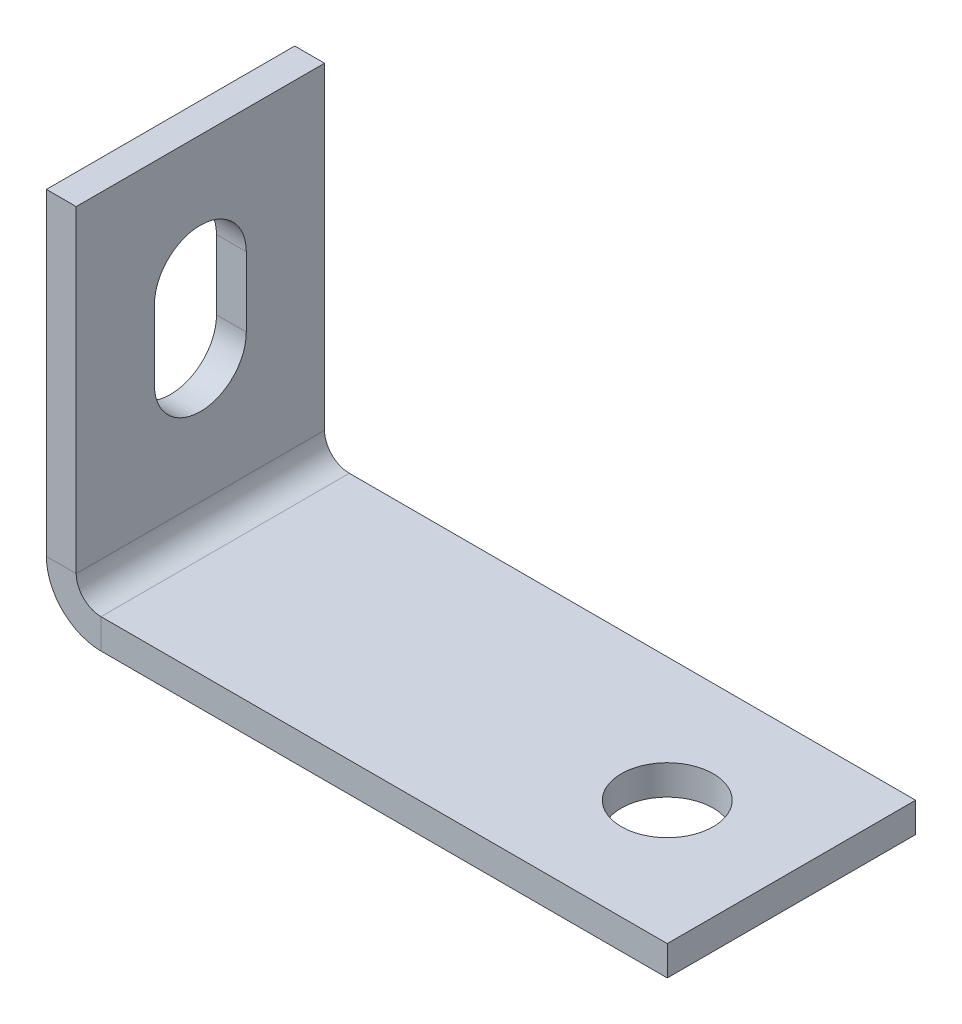
from build123d import *

# Parameters (mm, degrees)
T_LE_DE_BASE_PLI_E1_DEPTH = 10
ENL_V_MAT_EXTRU_1_REACH   = 32.256
ESQUISSE6_R               = 1.85
ENL_V_MAT_EXTRU_2_REACH   = 31.857


# Sheet-metal steps are written as plain solids
with BuildPart() as part:
    # Esquisse1 → Tôle de base pliée1 (new body)
    with BuildSketch(Plane.XY):
        with BuildLine():
            Line((0, 15), (0, 2.2))
            ThreePointArc((0, 2.2), (0.644365081, 0.644365081), (2.2, 0))
            Line((2.2, 0), (25, 0))
            Line((25, 0), (25, 1.2))
            Line((25, 1.2), (2.2, 1.2))
            ThreePointArc((2.2, 1.2), (1.492893219, 1.492893219), (1.2, 2.2))
            Line((1.2, 2.2), (1.2, 15))
            Line((1.2, 15), (0, 15))
        make_face()
    extrude(amount=T_LE_DE_BASE_PLI_E1_DEPTH)

    # Esquisse6 → Enlèv. mat.-Extru.1 (cut, up to next)
    with BuildSketch(Plane(origin=(0, 1.2, 0), x_dir=(1, 0, 0), z_dir=(0, 1, 0)), mode=Mode.PRIVATE) as enl_v_mat_extru_1_sk1:
        with Locations(Location((20, -5, 0), (0, 0, 270))):
            Circle(ESQUISSE6_R)
    enl_v_mat_extru_1_tool1 = extrude(enl_v_mat_extru_1_sk1.sketch, amount=-ENL_V_MAT_EXTRU_1_REACH, mode=Mode.PRIVATE) & part.part
    add(enl_v_mat_extru_1_tool1.solids().sort_by_distance((20, 1.2, 5))[0], mode=Mode.SUBTRACT)

    # Esquisse7 → Enlèv. mat.-Extru.2 (cut, up to next)
    with BuildSketch(Plane(origin=(1.2, 0, 0), x_dir=(0, 0, -1), z_dir=(1, 0, 0)), mode=Mode.PRIVATE) as enl_v_mat_extru_2_sk1:
        with BuildLine():
            Line((-3.15, 10), (-3.15, 7.2))
            ThreePointArc((-3.15, 7.2), (-5, 5.35), (-6.85, 7.2))
            Line((-6.85, 7.2), (-6.85, 10))
            ThreePointArc((-6.85, 10), (-5, 11.85), (-3.15, 10))
        make_face()
    enl_v_mat_extru_2_tool1 = extrude(enl_v_mat_extru_2_sk1.sketch, amount=-ENL_V_MAT_EXTRU_2_REACH, mode=Mode.PRIVATE) & part.part
    add(enl_v_mat_extru_2_tool1.solids().sort_by_distance((1.2, 8.6, 5))[0], mode=Mode.SUBTRACT)


solid = part.part
